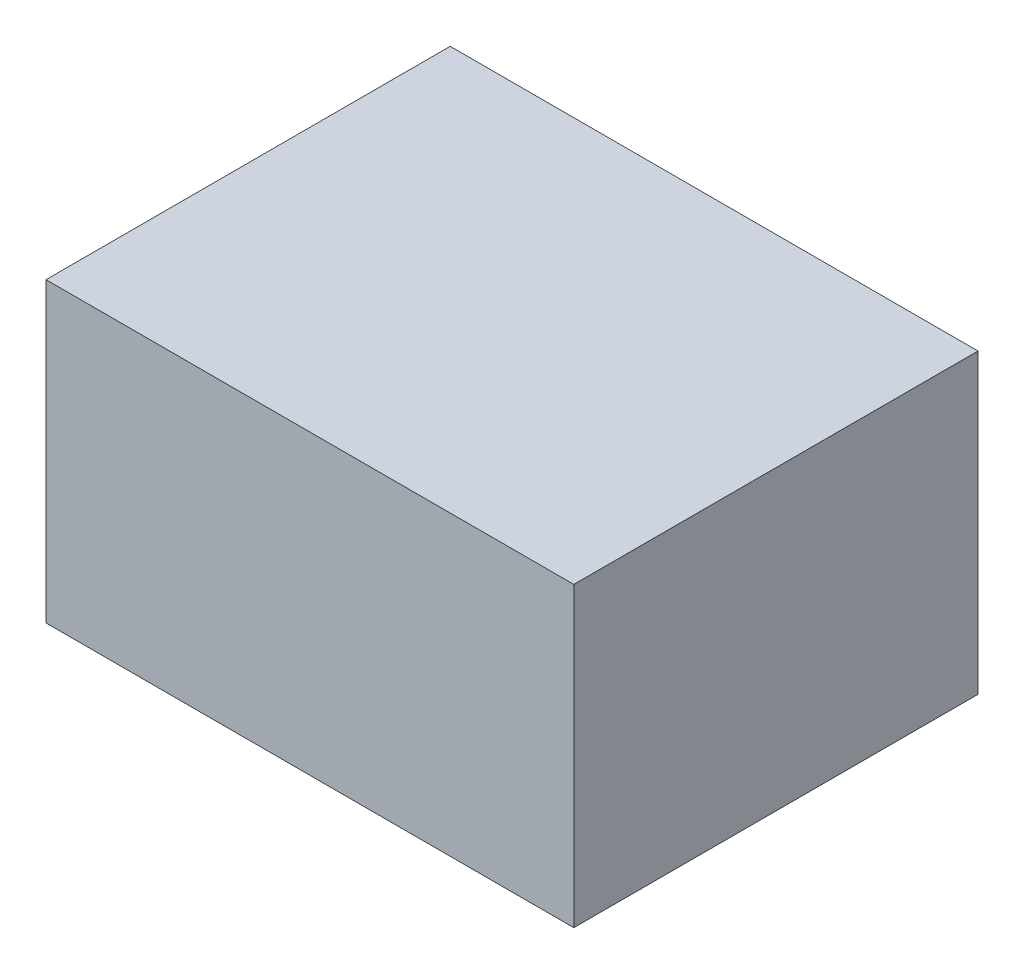
from build123d import *

# Parameters (mm, degrees)
SKETCH1_W           = 316
SKETCH1_H           = 242
BOSS_EXTRUDE1_DEPTH = 178


with BuildPart() as part:
    # Sketch1 → Boss-Extrude1 (new body)
    with BuildSketch(Plane(origin=(0, 0, 0), x_dir=(1, 0, 0), z_dir=(0, 1, 0))):
        Rectangle(SKETCH1_W, SKETCH1_H)
    extrude(amount=BOSS_EXTRUDE1_DEPTH)


solid = part.part
